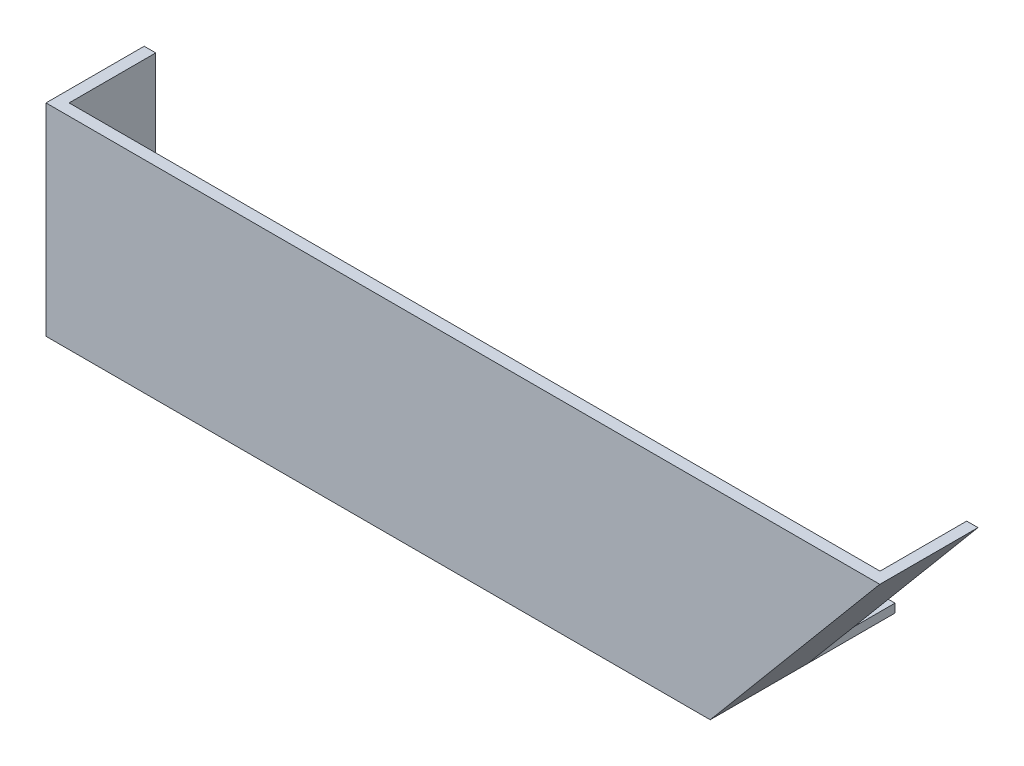
from build123d import *

# Parameters (mm, degrees)
BOSS_EXTRUDE1_DEPTH = 4
SKETCH2_W           = 4
SKETCH2_H           = 70
BOSS_EXTRUDE2_DEPTH = 30
SKETCH3_W           = 226
SKETCH3_H           = 3
BOSS_EXTRUDE3_DEPTH = 60
BOSS_EXTRUDE4_DEPTH = 30


with BuildPart() as part:
    # Sketch1 → Boss-Extrude1 (new body)
    with BuildSketch(Plane.XY):
        Polygon((95.034246575, 49.434931507), (153.771220758, 119.434931507), (95.034246575, 119.434931507), (-134.965753425, 119.434931507), (-134.965753425, 49.434931507), align=None)
    extrude(amount=BOSS_EXTRUDE1_DEPTH)

    # Sketch2 → Boss-Extrude2 (add)
    with BuildSketch(Plane(origin=(0, 0, 0), x_dir=(-1, 0, 0), z_dir=(0, 0, -1))):
        with Locations((132.965753425, 84.434931507)):
            Rectangle(SKETCH2_W, SKETCH2_H)
    extrude(amount=BOSS_EXTRUDE2_DEPTH)

    # Sketch3 → Boss-Extrude3 (add)
    with BuildSketch(Plane(origin=(0, 0, 0), x_dir=(-1, 0, 0), z_dir=(0, 0, -1))):
        with Locations((17.965753425, 50.934931507)):
            Rectangle(SKETCH3_W, SKETCH3_H)
    extrude(amount=BOSS_EXTRUDE3_DEPTH)

    # Sketch4 → Boss-Extrude4 (add)
    with BuildSketch(Plane(origin=(0, 0, 0), x_dir=(-1, 0, 0), z_dir=(0, 0, -1))):
        Polygon((-153.771220758, 119.434931507), (-95.034246575, 49.434931507), (-92.736113246, 51.363294336), (-149.85499889, 119.434931507), align=None)
    extrude(amount=BOSS_EXTRUDE4_DEPTH)


solid = part.part
